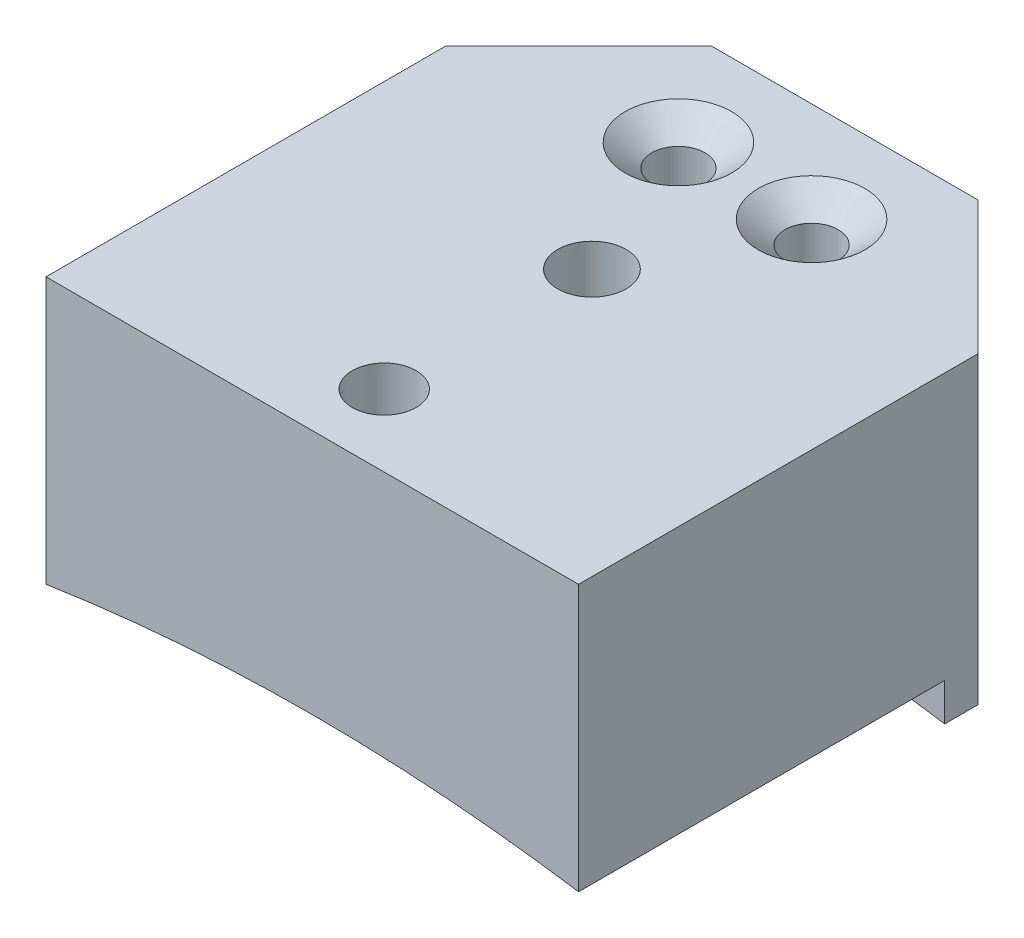
from build123d import *

# Parameters (mm, degrees)
BOSS_EXTRUDE1_DEPTH                                = 12.7
CUT_EXTRUDE1_DEPTH                                 = 41.241448839
CUT_EXTRUDE1_DEPTH_BACK                            = 41.241448839
SKETCH2_R                                          = 83.82
BOSS_EXTRUDE2_DEPTH                                = 7.9375
CHAMFER1_SIZE                                      = 6.35
CSK_FOR_10_FLAT_HEAD_MACHINE_SCREW_100_D           = 2.54
CSK_FOR_10_FLAT_HEAD_MACHINE_SCREW_100_CSINK_D     = 5.08
CSK_FOR_10_FLAT_HEAD_MACHINE_SCREW_100_CSINK_ANGLE = 100
CUT_EXTRUDE2_DEPTH                                 = 35.469591438


with BuildPart() as part:
    # Sketch1 → Boss-Extrude1 (new body)
    with BuildSketch(Plane(origin=(0, 0, 0), x_dir=(1, 0, 0), z_dir=(0, 1, 0))):
        Polygon((-28.511825699, 6.495271113), (-22.161825699, 12.845271113), (-9.461825699, 12.845271113), (-3.111825699, 6.495271113), (-3.111825699, -12.554728887), (-28.511825699, -12.554728887), align=None)
    extrude(amount=BOSS_EXTRUDE1_DEPTH)

    # Sketch2 → Cut-Extrude1 (cut, two sides: drawn at the far end of the back side and taken through both)
    with BuildSketch(Plane.XY.offset(12.554728887).offset(-CUT_EXTRUDE1_DEPTH_BACK)):
        with Locations((-15.811825699, -82.852292666)):
            Circle(SKETCH2_R)
    extrude(amount=CUT_EXTRUDE1_DEPTH + CUT_EXTRUDE1_DEPTH_BACK, mode=Mode.SUBTRACT)

    # Sketch5 → Boss-Extrude2 (add)
    with BuildSketch(Plane(origin=(0, 0, -12.845271113), x_dir=(-1, 0, 0), z_dir=(0, 0, -1))):
        with BuildLine():
            Line((3.111825699, 12.7), (3.111825699, 0))
            Line((3.111825699, 0), (3.111825699, -1.799225087))
            ThreePointArc((3.111825699, -1.799225087), (15.811825699, -0.810292666), (28.511825699, -1.799225087))
            Line((28.511825699, -1.799225087), (28.511825699, 0))
            Line((28.511825699, 0), (28.511825699, 12.7))
            Line((28.511825699, 12.7), (3.111825699, 12.7))
        make_face()
    extrude(amount=-BOSS_EXTRUDE2_DEPTH)

    # Chamfer1
    chamfer1_edges = [part.edges().sort_by_distance(p)[0] for p in [
        (-28.511825699, 5.450387457, -12.845271113),
        (-3.111825699, 5.450387457, -12.845271113),
    ]]
    chamfer(chamfer1_edges, length=CHAMFER1_SIZE)

    # CSK for #10 Flat Head Machine Screw (100)1 (through all)
    with Locations(Plane(origin=(0, 12.7, 0), x_dir=(1, 0, 0), z_dir=(0, 1, 0))):
        with Locations((-18.986825699, 8.082771113), (-12.636825699, 8.082771113)):
            CounterSinkHole(CSK_FOR_10_FLAT_HEAD_MACHINE_SCREW_100_D / 2, CSK_FOR_10_FLAT_HEAD_MACHINE_SCREW_100_CSINK_D / 2, counter_sink_angle=CSK_FOR_10_FLAT_HEAD_MACHINE_SCREW_100_CSINK_ANGLE)

    # Sketch6 → Cut-Extrude2 (cut, through all)
    with BuildSketch(Plane(origin=(0, 12.7, 0), x_dir=(1, 0, 0), z_dir=(0, 1, 0))):
        with BuildLine():
            add(Edge.make_bspline(
                [(-15.810187161, -10.649728887), (-15.608816069, -10.649728887), (-15.408777087, -10.609258042), (-15.042113414, -10.456913102), (-14.872283136, -10.343310195), (-14.661403237, -10.132093223), (-14.597095235, -10.053567675), (-14.486747252, -9.887951619), (-14.439987535, -9.800364966), (-14.325350321, -9.523041064), (-14.285983587, -9.325167956), (-14.286290626, -9.023681247), (-14.296234835, -8.924756645), (-14.335129975, -8.729941243), (-14.364583859, -8.633021866), (-14.441157352, -8.448760184), (-14.488024203, -8.361269055), (-14.59887818, -8.19554373), (-14.663276798, -8.117242645), (-14.874254427, -7.906673959), (-15.044430287, -7.793212195), (-15.411336895, -7.641510946), (-15.611812582, -7.601658558), (-15.910183793, -7.601764194), (-16.011184079, -7.611765087), (-16.206424053, -7.650777196), (-16.30141986, -7.679610607), (-16.578437934, -7.794438792), (-16.746192198, -7.906327472), (-16.959455446, -8.119808368), (-17.022421419, -8.196790525), (-17.132721662, -8.361961239), (-17.180436007, -8.451221081), (-17.256716781, -8.635734127), (-17.285478891, -8.730735016), (-17.324351045, -8.926195298), (-17.33424011, -9.027147637), (-17.3340816, -9.325321862), (-17.294056516, -9.525871287), (-17.142043719, -9.892631786), (-17.028500472, -10.062651874), (-16.817622682, -10.273567653), (-16.739189096, -10.337937728), (-16.573527751, -10.448531182), (-16.4859941, -10.495341779), (-16.301435, -10.571837459), (-16.204652049, -10.601138186), (-16.009875231, -10.63984903), (-15.910872707, -10.649728887), (-15.810187161, -10.649728887)],
                knots=[0, 0, 0, 0, 0.0625, 0.0625, 0.125, 0.125, 0.15625, 0.15625, 0.1875, 0.1875, 0.25, 0.25, 0.28125, 0.28125, 0.3125, 0.3125, 0.34375, 0.34375, 0.375, 0.375, 0.4375, 0.4375, 0.5, 0.5, 0.53125, 0.53125, 0.5625, 0.5625, 0.625, 0.625, 0.65625, 0.65625, 0.6875, 0.6875, 0.71875, 0.71875, 0.75, 0.75, 0.8125, 0.8125, 0.875, 0.875, 0.90625, 0.90625, 0.9375, 0.9375, 0.96875, 0.96875, 1, 1, 1, 1], degree=3))
        make_face()
        with BuildLine():
            add(Edge.make_bspline(
                [(-17.442014074, 0.780271113), (-17.442014074, 0.564636284), (-17.398676558, 0.350427917), (-17.235540464, -0.042207871), (-17.113890664, -0.224067842), (-16.887712317, -0.449885239), (-16.803624494, -0.518748425), (-16.626277278, -0.636912744), (-16.532486538, -0.686984635), (-16.235518686, -0.809742063), (-16.023629558, -0.851897237), (-15.700787746, -0.851568442), (-15.594856021, -0.840919858), (-15.386241213, -0.799269638), (-15.2824567, -0.767729417), (-15.085143228, -0.685731965), (-14.991454814, -0.635545363), (-14.813990575, -0.51683914), (-14.730143192, -0.447878932), (-14.50465928, -0.22195697), (-14.383160661, -0.039726886), (-14.220713993, 0.353169004), (-14.178038765, 0.567845014), (-14.178151883, 0.887350822), (-14.188861164, 0.995505271), (-14.230636596, 1.204574676), (-14.261512351, 1.30629934), (-14.343486893, 1.504059479), (-14.394580348, 1.59939761), (-14.512809992, 1.776109619), (-14.580489093, 1.858699522), (-14.732890677, 2.010945721), (-14.815325719, 2.078371766), (-14.992196017, 2.196484915), (-15.087778447, 2.247579015), (-15.285361108, 2.329262955), (-15.387091204, 2.360062361), (-15.596396557, 2.401687932), (-15.704499652, 2.412277461), (-16.023794479, 2.412107726), (-16.238549476, 2.369247574), (-16.631288933, 2.206467282), (-16.813352191, 2.084881425), (-17.03920796, 1.859066471), (-17.10813762, 1.77507717), (-17.226564819, 1.597681506), (-17.276691184, 1.503947566), (-17.358605332, 1.306315551), (-17.389981529, 1.202677168), (-17.431434394, 0.994103708), (-17.442014074, 0.888088528), (-17.442014074, 0.780271113)],
                knots=[0, 0, 0, 0, 0.0625, 0.0625, 0.125, 0.125, 0.15625, 0.15625, 0.1875, 0.1875, 0.25, 0.25, 0.28125, 0.28125, 0.3125, 0.3125, 0.34375, 0.34375, 0.375, 0.375, 0.4375, 0.4375, 0.5, 0.5, 0.53125, 0.53125, 0.5625, 0.5625, 0.59375, 0.59375, 0.625, 0.625, 0.65625, 0.65625, 0.6875, 0.6875, 0.71875, 0.71875, 0.75, 0.75, 0.8125, 0.8125, 0.875, 0.875, 0.90625, 0.90625, 0.9375, 0.9375, 0.96875, 0.96875, 1, 1, 1, 1], degree=3))
        make_face()
    extrude(amount=-CUT_EXTRUDE2_DEPTH, mode=Mode.SUBTRACT)


solid = part.part
